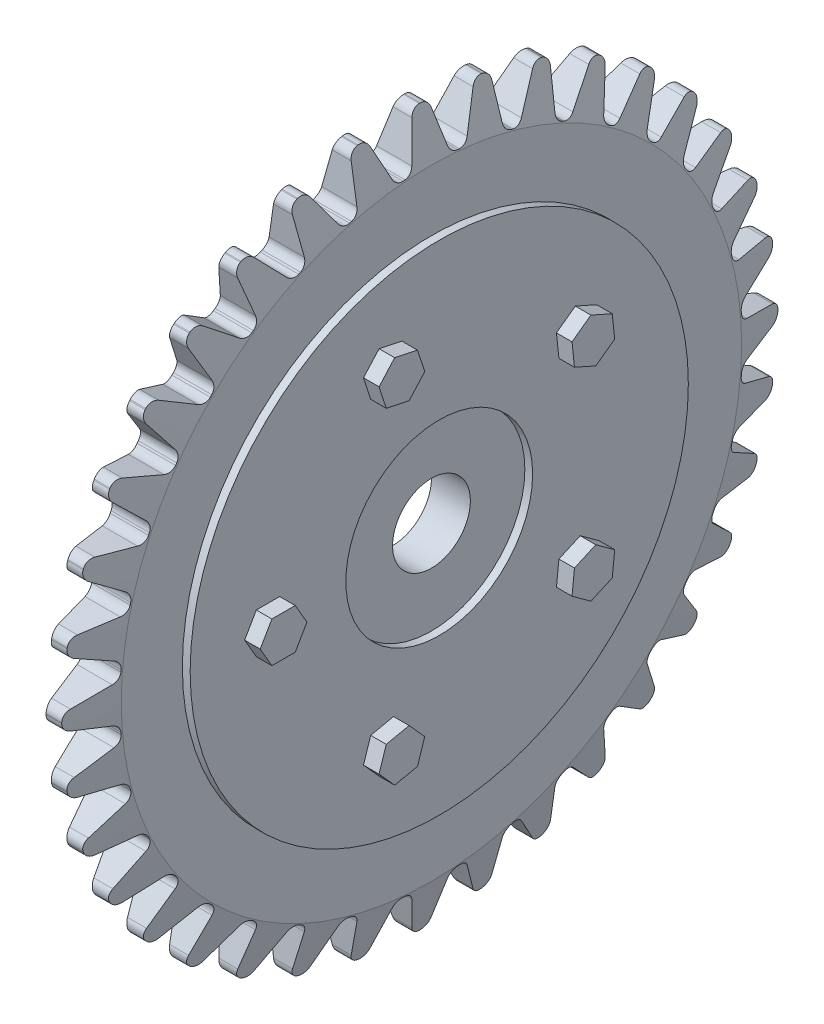
from build123d import *

# Parameters (mm, degrees)
SKETCH1_R           = 40
SKETCH1_R_2         = 5
BOSS_EXTRUDE1_DEPTH = 2.5
SKETCH1_3_R         = 32
SKETCH1_3_R_2       = 12
BOSS_EXTRUDE2_DEPTH = 3.5
BOSS_EXTRUDE3_DEPTH = 5.5
CIRPATTERN1_COUNT   = 5
BOSS_EXTRUDE4_DEPTH = 2.5
CIRPATTERN2_COUNT   = 36


with BuildPart() as part:
    # Sketch1 → Boss-Extrude1 (new, symmetric)
    with BuildSketch(Plane.YZ):
        Circle(SKETCH1_R)
        Circle(SKETCH1_R_2, mode=Mode.SUBTRACT)
    extrude(amount=BOSS_EXTRUDE1_DEPTH, both=True)

    # Sketch1<3> → Boss-Extrude2 (add, symmetric)
    with BuildSketch(Plane.YZ):
        Circle(SKETCH1_3_R)
        Circle(SKETCH1_3_R_2, mode=Mode.SUBTRACT)
    extrude(amount=BOSS_EXTRUDE2_DEPTH, both=True)

    # Sketch1<4> → Boss-Extrude3 (add, symmetric)
    with BuildSketch(Plane.YZ):
        Polygon((-2.598076211, 20.5), (0, 19), (2.598076211, 20.5), (2.598076211, 23.5), (0, 25), (-2.598076211, 23.5), align=None)
    boss_extrude3 = extrude(amount=BOSS_EXTRUDE3_DEPTH, both=True)

    # CirPattern1: Boss-Extrude3 ×5 about axis
    cirpattern1_axis = Axis((3.5, 0, 0), (1, 0, 0))
    for i in range(1, CIRPATTERN1_COUNT):
        add(boss_extrude3.rotate(cirpattern1_axis, i * 360 / CIRPATTERN1_COUNT))

    # Sketch1<5> → Boss-Extrude4 (add, symmetric)
    with BuildSketch(Plane.YZ):
        with BuildLine():
            ThreePointArc((-0.05941398, 45.99996163), (-0.798203785, 45.744365658), (-1.222791516, 45.087962629))
            Line((-1.222791516, 45.087962629), (-2.291096046, 40.766791458))
            ThreePointArc((-2.291096046, 40.766791458), (-2.677280716, 40.141796572), (-3.355362633, 39.859020831))
            ThreePointArc((-3.355362633, 39.859020831), (0, 40), (3.355362633, 39.859020831))
            ThreePointArc((3.355362633, 39.859020831), (2.677280716, 40.141796572), (2.291096046, 40.766791458))
            Line((2.291096046, 40.766791458), (1.222791516, 45.087962629))
            ThreePointArc((1.222791516, 45.087962629), (0.798203785, 45.744365658), (0.05941398, 45.99996163))
            ThreePointArc((0.05941398, 45.99996163), (0, 46), (-0.05941398, 45.99996163))
        make_face()
    boss_extrude4 = extrude(amount=BOSS_EXTRUDE4_DEPTH, both=True)

    # CirPattern2: Boss-Extrude4 ×36 about axis
    cirpattern2_axis = Axis((-2.5, 0, 0), (1, 0, 0))
    for i in range(1, CIRPATTERN2_COUNT):
        add(boss_extrude4.rotate(cirpattern2_axis, i * 360 / CIRPATTERN2_COUNT))

    # Sketch2 → Cut-Revolve1 (revolve, cut)
    with BuildSketch(Plane(origin=(0, 0, 0), x_dir=(-1, 0, 0), z_dir=(0, 1, 0))):
        Polygon((-2.5, 46.358720602), (-2.5, 39.84996163), (-0.912497812, 46.358720602), align=None)
        Polygon((0.912497812, 46.358720602), (2.5, 39.84996163), (2.5, 46.358720602), align=None)
    revolve(axis=Axis((9.453864993, 0, 0), (-1, 0, 0)), mode=Mode.SUBTRACT)


solid = part.part
